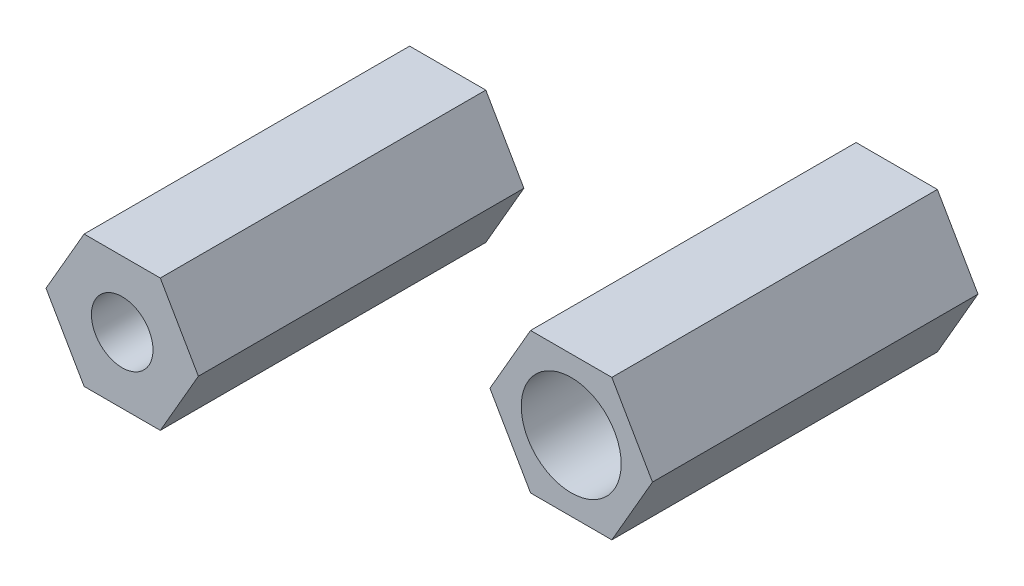
from build123d import *

# Parameters (mm, degrees)
SKETCH1_R              = 2.4
BOSS_EXTRUDE1_DEPTH    = 4
SKETCH2_R              = 5.678751563
BOSS_EXTRUDE2_DEPTH    = 33
DETECTOR_START         = 19.533020459
DETECTOR_OUTLINE_R     = 3.5
DETECTOR_DEPTH         = 37
DETECTOR_2_OUTLINE_R   = 3.5
DETECTOR_2_OUTLINE_R_2 = 2.4
DETECTOR_2_DEPTH       = 4


# Read off the part's stored shape, not the designer's step: detector
with BuildPart() as part:
    # Sketch1 → Boss-Extrude1 (new body)
    with BuildSketch(Plane.XY):
        Polygon((9.237604307, 0), (4.618802154, 8), (-4.618802154, 8), (-9.237604307, 0), (-4.618802154, -8), (4.618802154, -8), align=None)
        Circle(SKETCH1_R, mode=Mode.SUBTRACT)
    extrude(amount=BOSS_EXTRUDE1_DEPTH)

    # Sketch2 → Boss-Extrude2 (add)
    with BuildSketch(Plane.XY.offset(4)):
        Polygon((9.237604307, 0), (4.618802154, 8), (-4.618802154, 8), (-9.237604307, 0), (-4.618802154, -8), (4.618802154, -8), align=None)
        Circle(SKETCH2_R, mode=Mode.SUBTRACT)
    extrude(amount=BOSS_EXTRUDE2_DEPTH)


with BuildPart() as body_2:
    # detector outline → detector (new body)
    with BuildSketch(Plane.XY.offset(DETECTOR_START)):
        Polygon((-35.833674913, 11.648881449), (-40.163801932, 4.148881449), (-35.833674913, -3.351118551), (-27.173420875, -3.351118551), (-22.843293856, 4.148881449), (-27.173420875, 11.648881449), align=None)
        with Locations((-31.503547894, 4.148881449)):
            Circle(DETECTOR_OUTLINE_R, mode=Mode.SUBTRACT)
    extrude(amount=DETECTOR_DEPTH)

    # detector 2 outline → detector 2 (add)
    with BuildSketch(Plane.XY.offset(DETECTOR_START)):
        with Locations((-31.503547894, 4.148881449)):
            Circle(DETECTOR_2_OUTLINE_R)
        with Locations((-31.503547894, 4.148881449)):
            Circle(DETECTOR_2_OUTLINE_R_2, mode=Mode.SUBTRACT)
    extrude(amount=DETECTOR_2_DEPTH)


solid = Compound([part.part, body_2.part])
